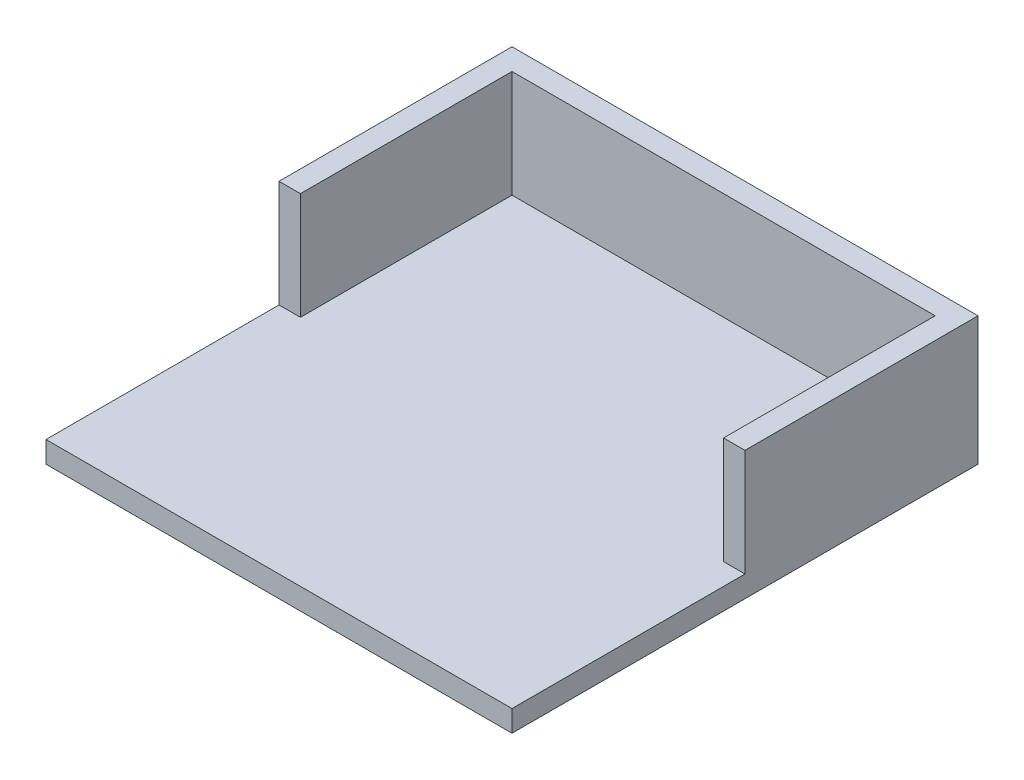
from build123d import *

# Parameters (mm, degrees)
SKETCH1_W           = 43.5
SKETCH1_H           = 43.5
BOSS_EXTRUDE1_DEPTH = 2
SKETCH2_W           = 43.5
SKETCH2_H           = 43.5
SKETCH2_W_2         = 39.5
SKETCH2_H_2         = 39.5
BOSS_EXTRUDE2_DEPTH = 10
SKETCH3_W           = 43.5
SKETCH3_H           = 21.75
CUT_EXTRUDE1_DEPTH  = 10


with BuildPart() as part:
    # Sketch1 → Boss-Extrude1 (new body)
    with BuildSketch(Plane(origin=(0, 0, 0), x_dir=(1, 0, 0), z_dir=(0, 1, 0))):
        with Locations((21.75, 21.75)):
            Rectangle(SKETCH1_W, SKETCH1_H)
    extrude(amount=BOSS_EXTRUDE1_DEPTH)

    # Sketch2 → Boss-Extrude2 (add)
    with BuildSketch(Plane(origin=(0, 2, 0), x_dir=(1, 0, 0), z_dir=(0, 1, 0))):
        with Locations((21.75, 21.75)):
            Rectangle(SKETCH2_W, SKETCH2_H)
        with Locations((21.75, 21.75)):
            Rectangle(SKETCH2_W_2, SKETCH2_H_2, mode=Mode.SUBTRACT)
    extrude(amount=BOSS_EXTRUDE2_DEPTH)

    # Sketch3 → Cut-Extrude1 (cut)
    with BuildSketch(Plane(origin=(0, 12, 0), x_dir=(1, 0, 0), z_dir=(0, 1, 0))):
        with Locations((21.75, 10.875)):
            Rectangle(SKETCH3_W, SKETCH3_H)
    extrude(amount=-CUT_EXTRUDE1_DEPTH, mode=Mode.SUBTRACT)


solid = part.part
